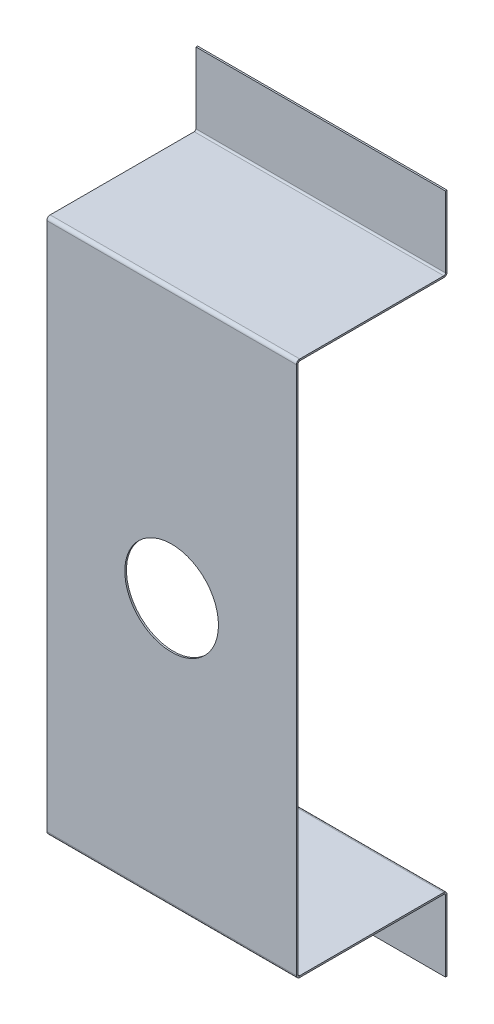
from build123d import *

# Parameters (mm, degrees)
BASE_FLANGE1_DEPTH = 19.05
SKETCH5_R          = 7.1501
CUT_EXTRUDE1_DEPTH = 60.846151665


# Sheet-metal steps are written as plain solids
with BuildPart() as part:
    # Sketch1 → Base-Flange1 (new, symmetric)
    with BuildSketch(Plane(origin=(0, 0, 0), x_dir=(0, 0, -1), z_dir=(1, 0, 0))):
        with BuildLine():
            Line((22.7584, 51.9684), (22.7584, 41.148))
            ThreePointArc((22.7584, 41.148), (22.609610245, 40.788789755), (22.2504, 40.64))
            Line((22.2504, 40.64), (0.254, 40.64))
            ThreePointArc((0.254, 40.64), (0.074394878, 40.565605122), (0, 40.386))
            Line((0, 40.386), (0, -40.386))
            ThreePointArc((0, -40.386), (0.074394878, -40.565605122), (0.254, -40.64))
            Line((0.254, -40.64), (22.2504, -40.64))
            ThreePointArc((22.2504, -40.64), (22.609610245, -40.788789755), (22.7584, -41.148))
            Line((22.7584, -41.148), (22.7584, -51.9684))
            Line((22.7584, -51.9684), (22.5044, -51.9684))
            Line((22.5044, -51.9684), (22.5044, -41.148))
            ThreePointArc((22.5044, -41.148), (22.430005122, -40.968394878), (22.2504, -40.894))
            Line((22.2504, -40.894), (0.254, -40.894))
            ThreePointArc((0.254, -40.894), (-0.105210245, -40.745210245), (-0.254, -40.386))
            Line((-0.254, -40.386), (-0.254, 40.386))
            ThreePointArc((-0.254, 40.386), (-0.105210245, 40.745210245), (0.254, 40.894))
            Line((0.254, 40.894), (22.2504, 40.894))
            ThreePointArc((22.2504, 40.894), (22.430005122, 40.968394878), (22.5044, 41.148))
            Line((22.5044, 41.148), (22.5044, 51.9684))
            Line((22.5044, 51.9684), (22.7584, 51.9684))
        make_face()
    extrude(amount=BASE_FLANGE1_DEPTH, both=True)

    # Sketch5 → Cut-Extrude1 (cut, through all)
    with BuildSketch(Plane.XY):
        Circle(SKETCH5_R)
    extrude(amount=CUT_EXTRUDE1_DEPTH, mode=Mode.SUBTRACT)


solid = part.part
